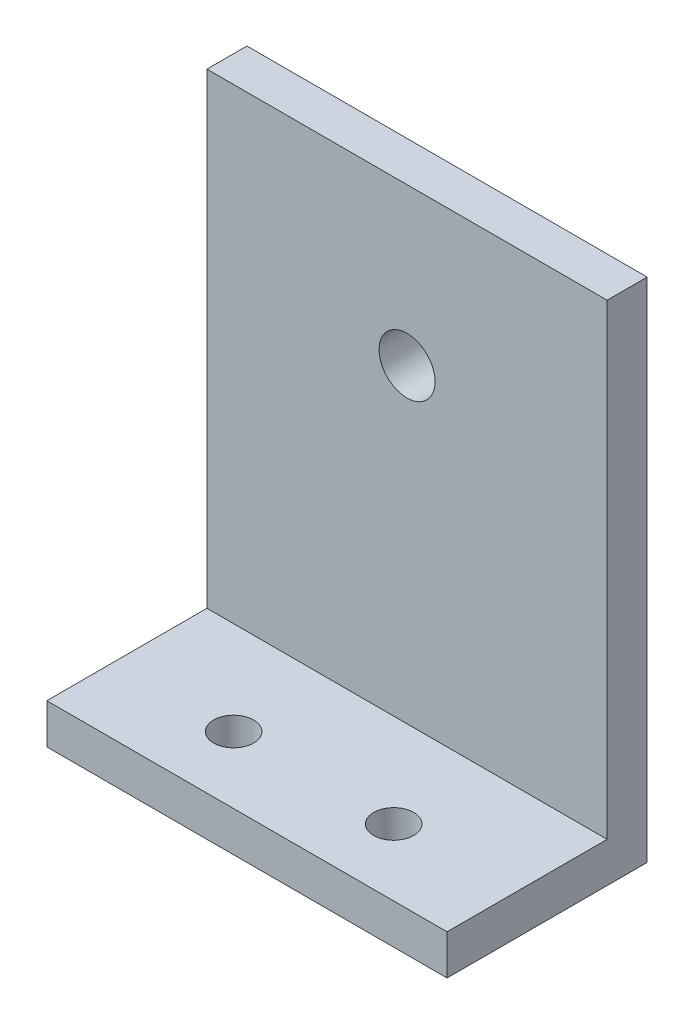
from build123d import *

# Parameters (mm, degrees)
EXTRUDE_1_DEPTH     = 30
CUT_EXTRUDE_1_REACH = 59.879
SKETCH_2_R          = 1.5
SKETCH_2_W          = 30
SKETCH_2_H          = 10
SKETCH_3_R          = 2.1
CUT_EXTRUDE_2_DEPTH = 53.440442409
SKETCH_4_W          = 30
SKETCH_4_H          = 3
CUT_EXTRUDE_3_DEPTH = 13


with BuildPart() as part:
    # 草图1 → 凸台-拉伸1 (new body)
    with BuildSketch(Plane(origin=(0, 0, 0), x_dir=(0, 0, -1), z_dir=(1, 0, 0))):
        Polygon((0, 0), (0, 35), (3, 35), (3, -3), (-35, -3), (-35, 0), align=None)
    extrude(amount=EXTRUDE_1_DEPTH)

    # 草图2 → 切除-拉伸1 (cut, up to next)
    with BuildSketch(Plane(origin=(0, 0, 0), x_dir=(1, 0, 0), z_dir=(0, 1, 0)), mode=Mode.PRIVATE) as cut_extrude_1_sk1:
        with Locations((9, -7)):
            Circle(SKETCH_2_R)
    cut_extrude_1_tool1 = extrude(cut_extrude_1_sk1.sketch, amount=-CUT_EXTRUDE_1_REACH, mode=Mode.PRIVATE) & part.part
    # 草图2 → 切除-拉伸1 (cut, up to next)
    with BuildSketch(Plane(origin=(0, 0, 0), x_dir=(1, 0, 0), z_dir=(0, 1, 0)), mode=Mode.PRIVATE) as cut_extrude_1_sk2:
        with Locations((9, -19)):
            Circle(SKETCH_2_R)
    cut_extrude_1_tool2 = extrude(cut_extrude_1_sk2.sketch, amount=-CUT_EXTRUDE_1_REACH, mode=Mode.PRIVATE) & part.part
    # 草图2 → 切除-拉伸1 (cut, up to next)
    with BuildSketch(Plane(origin=(0, 0, 0), x_dir=(1, 0, 0), z_dir=(0, 1, 0)), mode=Mode.PRIVATE) as cut_extrude_1_sk3:
        with Locations((21, -19)):
            Circle(SKETCH_2_R)
    cut_extrude_1_tool3 = extrude(cut_extrude_1_sk3.sketch, amount=-CUT_EXTRUDE_1_REACH, mode=Mode.PRIVATE) & part.part
    # 草图2 → 切除-拉伸1 (cut, up to next)
    with BuildSketch(Plane(origin=(0, 0, 0), x_dir=(1, 0, 0), z_dir=(0, 1, 0)), mode=Mode.PRIVATE) as cut_extrude_1_sk4:
        with Locations((21, -7)):
            Circle(SKETCH_2_R)
    cut_extrude_1_tool4 = extrude(cut_extrude_1_sk4.sketch, amount=-CUT_EXTRUDE_1_REACH, mode=Mode.PRIVATE) & part.part
    # 草图2 → 切除-拉伸1 (cut, up to next)
    with BuildSketch(Plane(origin=(0, 0, 0), x_dir=(1, 0, 0), z_dir=(0, 1, 0)), mode=Mode.PRIVATE) as cut_extrude_1_sk5:
        with Locations((15, -30)):
            Rectangle(SKETCH_2_W, SKETCH_2_H)
    cut_extrude_1_tool5 = extrude(cut_extrude_1_sk5.sketch, amount=-CUT_EXTRUDE_1_REACH, mode=Mode.PRIVATE) & part.part
    add(cut_extrude_1_tool1.solids().sort_by_distance((9, 0, 7))[0], mode=Mode.SUBTRACT)
    add(cut_extrude_1_tool2.solids().sort_by_distance((9, 0, 19))[0], mode=Mode.SUBTRACT)
    add(cut_extrude_1_tool3.solids().sort_by_distance((21, 0, 19))[0], mode=Mode.SUBTRACT)
    add(cut_extrude_1_tool4.solids().sort_by_distance((21, 0, 7))[0], mode=Mode.SUBTRACT)
    add(cut_extrude_1_tool5.solids().sort_by_distance((15, 0, 30))[0], mode=Mode.SUBTRACT)

    # 草图3 → 切除-拉伸2 (cut, through all)
    with BuildSketch(Plane.XY):
        with Locations((15, 23.25)):
            Circle(SKETCH_3_R)
    extrude(amount=-CUT_EXTRUDE_2_DEPTH, mode=Mode.SUBTRACT)

    # 草图4 → 切除-拉伸3 (cut)
    with BuildSketch(Plane.XY.offset(25)):
        with Locations((15, -1.5)):
            Rectangle(SKETCH_4_W, SKETCH_4_H)
    extrude(amount=-CUT_EXTRUDE_3_DEPTH, mode=Mode.SUBTRACT)


solid = part.part
